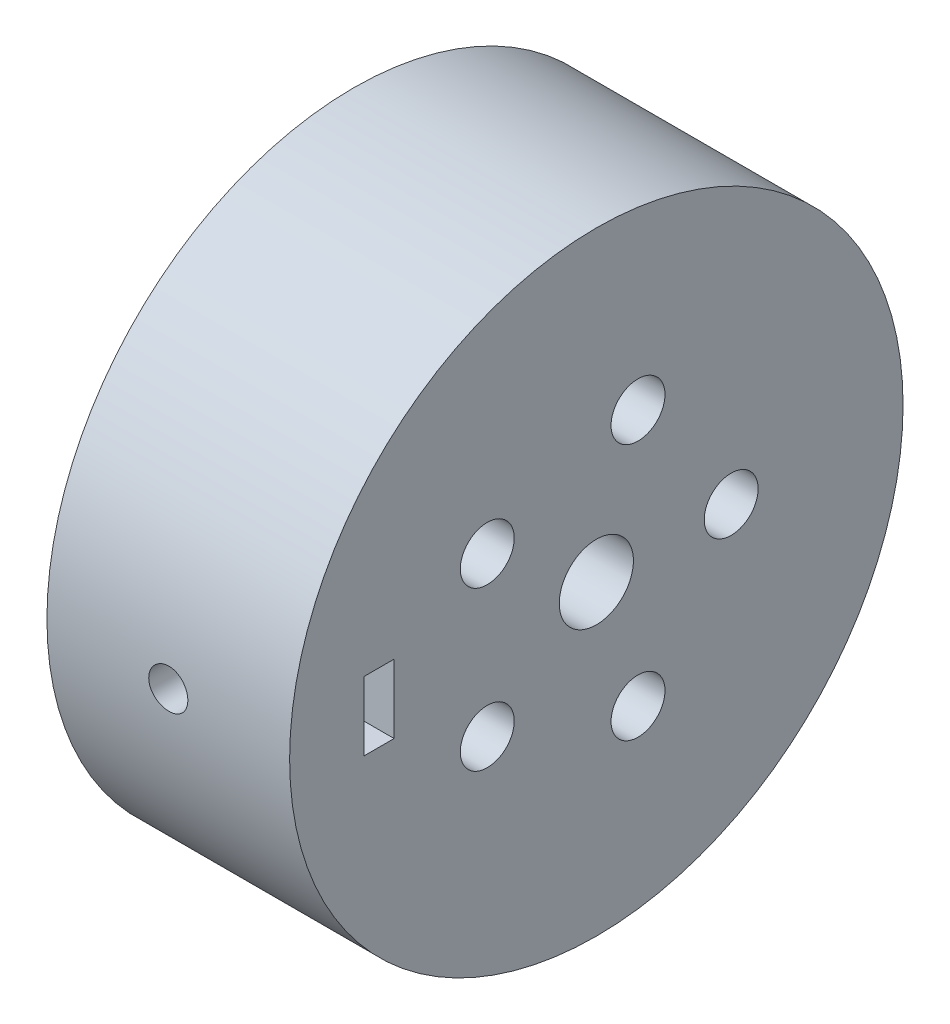
from build123d import *

# Parameters (mm, degrees)
ESQUISSE1_W             = 18
ESQUISSE1_H             = 20
ESQUISSE4_W             = 2.25
ESQUISSE4_H             = 5.1
ENL_V_MAT_EXTRU_1_DEPTH = 15
ESQUISSE6_W             = 1.45
ESQUISSE6_H             = 22.75


# Read off the part's stored shape, not the designer's step: Diamètre du perçage Ø4.0 (4)1
with BuildPart() as part:
    # Esquisse1 → Révolution1 (revolve)
    with BuildSketch(Plane.XY, mode=Mode.PRIVATE) as r_volution1_sk:
        with Locations((9, 12.75)):
            Rectangle(ESQUISSE1_W, ESQUISSE1_H)
    revolve(r_volution1_sk.sketch.rotate(Axis((0, 0, 0), (1, 0, 0)), 90), axis=Axis((0, 0, 0), (1, 0, 0)))

    # Diamètre du perçage Ø4.0 (4)1 outline → Diamètre du perçage Ø4.0 (4)1 (revolve, cut)
    with BuildSketch(Plane(origin=(0, -9.510565163, -3.090169944), x_dir=(0, 1, 0), z_dir=(0, 0, -1))):
        Polygon((0, 18), (0, 8.298278762), (2, 9.5), (2, 18), align=None)
    revolve(axis=Axis((0, -9.510565163, -3.090169944), (1, 0, 0)), mode=Mode.SUBTRACT)

    # Diam_tre du per_age _4.0 _4_1 2 outline → Diam_tre du per_age _4.0 _4_1 2 (revolve, cut)
    with BuildSketch(Plane(origin=(0, -5.877852523, 8.090169944), x_dir=(0, 1, 0), z_dir=(0, 0, -1))):
        Polygon((0, 18), (0, 8.298278762), (2, 9.5), (2, 18), align=None)
    revolve(axis=Axis((0, -5.877852523, 8.090169944), (1, 0, 0)), mode=Mode.SUBTRACT)

    # Diam_tre du per_age _4.0 _4_1 3 outline → Diam_tre du per_age _4.0 _4_1 3 (revolve, cut)
    with BuildSketch(Plane(origin=(0, 5.877852523, 8.090169944), x_dir=(0, 1, 0), z_dir=(0, 0, -1))):
        Polygon((0, 18), (0, 8.298278762), (2, 9.5), (2, 18), align=None)
    revolve(axis=Axis((0, 5.877852523, 8.090169944), (1, 0, 0)), mode=Mode.SUBTRACT)

    # Diam_tre du per_age _4.0 _4_1 4 outline → Diam_tre du per_age _4.0 _4_1 4 (revolve, cut)
    with BuildSketch(Plane(origin=(0, 9.510565163, -3.090169944), x_dir=(0, 1, 0), z_dir=(0, 0, -1))):
        Polygon((0, 18), (0, 8.298278762), (2, 9.5), (2, 18), align=None)
    revolve(axis=Axis((0, 9.510565163, -3.090169944), (1, 0, 0)), mode=Mode.SUBTRACT)

    # Diam_tre du per_age _4.0 _4_1 5 outline → Diam_tre du per_age _4.0 _4_1 5 (revolve, cut)
    with BuildSketch(Plane.YX.offset(10)):
        Polygon((0, 18), (0, 8.298278762), (2, 9.5), (2, 18), align=None)
    revolve(axis=Axis((0, 0, -10), (1, 0, 0)), mode=Mode.SUBTRACT)

    # Esquisse4 → Enlèv. mat.-Extru.1 (cut)
    with BuildSketch(Plane(origin=(18, 0, 0), x_dir=(0, 0, -1), z_dir=(1, 0, 0))):
        with Locations((-16.125, 0)):
            Rectangle(ESQUISSE4_W, ESQUISSE4_H)
    extrude(amount=-ENL_V_MAT_EXTRU_1_DEPTH, mode=Mode.SUBTRACT)

    # Esquisse6 → Dégagement M2.51 (revolve, cut)
    with BuildSketch(Plane.YZ.offset(9)):
        with Locations((0.725, 11.375)):
            Rectangle(ESQUISSE6_W, ESQUISSE6_H)
    revolve(axis=Axis((9, 0, -6.35), (0, 0, 1)), mode=Mode.SUBTRACT)


solid = part.part
